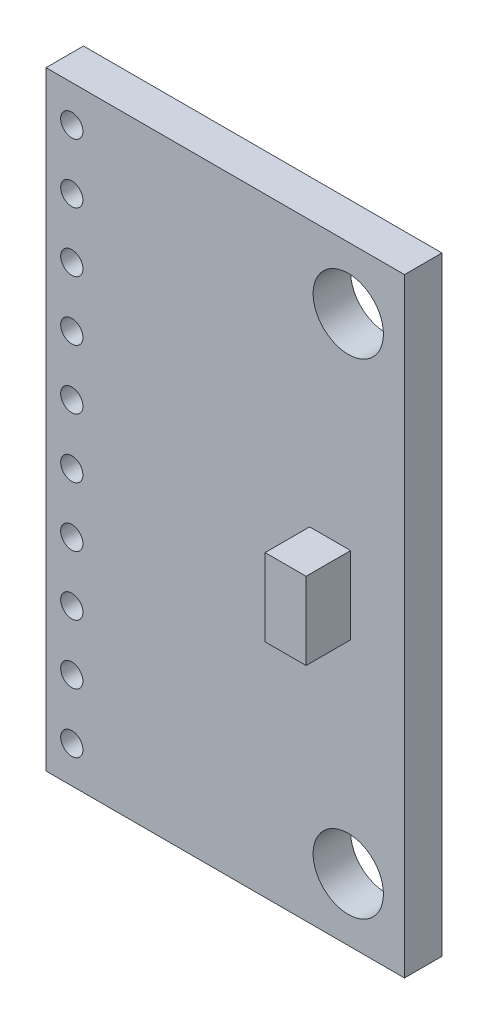
from build123d import *

# Parameters (mm, degrees)
SKETCH_1_W             = 15.3
SKETCH_1_H             = 26
EXTRUDE_1_DEPTH        = 1.6
CUT_EXTRUDE_1_REACH    = 17.168
SKETCH_2_R             = 1.5
SKETCH_3_W             = 1.75
SKETCH_3_H             = 3.3
EXTRUDE_2_DEPTH        = 1.9
CUT_EXTRUDE_2_REACH    = 17.203
SKETCH_4_R             = 0.475
PATTERN_LINEAR_1_COUNT = 5
PATTERN_LINEAR_1_PITCH = 2.54
MIRROR_START           = -1.6
MIRROR_1_OUTLINE_R     = 0.475
MIRROR_1_DEPTH         = 1.6


# Read off the part's stored shape, not the designer's step: 镜向1
with BuildPart() as part:
    # 草图1 → 凸台-拉伸1 (new body)
    with BuildSketch(Plane.XY):
        Rectangle(SKETCH_1_W, SKETCH_1_H)
    extrude(amount=-EXTRUDE_1_DEPTH)

    # 草图2 → 切除-拉伸1 (cut, up to next)
    with BuildSketch(Plane.XY, mode=Mode.PRIVATE) as cut_extrude_1_sk1:
        with Locations((5.25, -10.35)):
            Circle(SKETCH_2_R)
    cut_extrude_1_tool1 = extrude(cut_extrude_1_sk1.sketch, amount=-CUT_EXTRUDE_1_REACH, mode=Mode.PRIVATE) & part.part
    # 草图2 → 切除-拉伸1 (cut, up to next)
    with BuildSketch(Plane.XY, mode=Mode.PRIVATE) as cut_extrude_1_sk2:
        with Locations((5.25, 10.35)):
            Circle(SKETCH_2_R)
    cut_extrude_1_tool2 = extrude(cut_extrude_1_sk2.sketch, amount=-CUT_EXTRUDE_1_REACH, mode=Mode.PRIVATE) & part.part
    add(cut_extrude_1_tool1.solids().sort_by_distance((5.25, -10.35, 0))[0], mode=Mode.SUBTRACT)
    add(cut_extrude_1_tool2.solids().sort_by_distance((5.25, 10.35, 0))[0], mode=Mode.SUBTRACT)

    # 草图3 → 凸台-拉伸2 (add)
    with BuildSketch(Plane.XY):
        with Locations((4.475, 0)):
            Rectangle(SKETCH_3_W, SKETCH_3_H)
    extrude(amount=EXTRUDE_2_DEPTH)

    # 草图4 → 切除-拉伸2 (cut, up to next)
    with BuildSketch(Plane.XY, mode=Mode.PRIVATE) as cut_extrude_2_sk1:
        with Locations((-6.55, 1.27)):
            Circle(SKETCH_4_R)
    cut_extrude_2_tool1 = extrude(cut_extrude_2_sk1.sketch, amount=-CUT_EXTRUDE_2_REACH, mode=Mode.PRIVATE) & part.part
    # 草图4 → 切除-拉伸2 (cut, up to next)
    with BuildSketch(Plane.XY, mode=Mode.PRIVATE) as cut_extrude_2_sk2:
        with Locations((-6.55, -1.27)):
            Circle(SKETCH_4_R)
    cut_extrude_2_tool2 = extrude(cut_extrude_2_sk2.sketch, amount=-CUT_EXTRUDE_2_REACH, mode=Mode.PRIVATE) & part.part
    cut_extrude_2_1 = cut_extrude_2_tool1.solids().sort_by_distance((-6.55, 1.27, 0))[0]
    add(cut_extrude_2_1, mode=Mode.SUBTRACT)
    cut_extrude_2_2 = cut_extrude_2_tool2.solids().sort_by_distance((-6.55, -1.27, 0))[0]
    add(cut_extrude_2_2, mode=Mode.SUBTRACT)
    cut_extrude_2 = cut_extrude_2_1 + cut_extrude_2_2  # 切除-拉伸2 as one shape, for the pattern or mirror that repeats it

    # 阵列(线性)1: 切除-拉伸2 ×5
    with Locations(*[(0, i * PATTERN_LINEAR_1_PITCH, 0) for i in range(1, PATTERN_LINEAR_1_COUNT)]):
        add(cut_extrude_2, mode=Mode.SUBTRACT)

    # 镜向1 outline → 镜向1 (cut)
    with BuildSketch(Plane.XY.offset(MIRROR_START)):
        with Locations((-6.55, -6.35)):
            Circle(MIRROR_1_OUTLINE_R)
        with Locations((-6.55, -3.81)):
            Circle(MIRROR_1_OUTLINE_R)
        with Locations((-6.55, -11.43)):
            Circle(MIRROR_1_OUTLINE_R)
        with Locations((-6.55, -8.89)):
            Circle(MIRROR_1_OUTLINE_R)
    extrude(amount=MIRROR_1_DEPTH, mode=Mode.SUBTRACT)


solid = part.part
